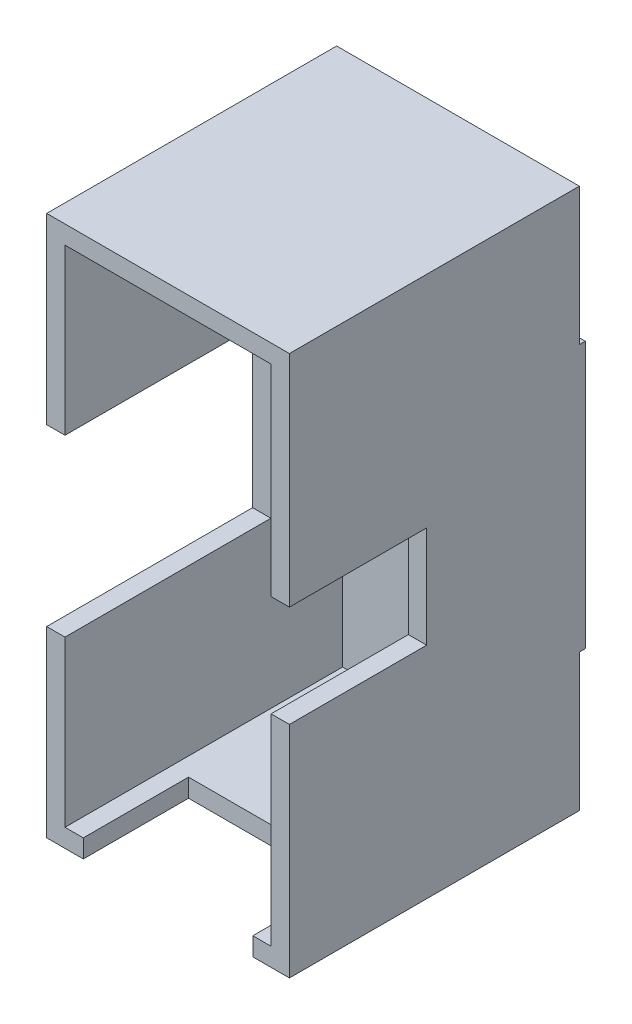
from build123d import *
from build123d.topology import SkipClean

# Parameters (mm, degrees)
SKETCH1_W           = 53.05
SKETCH1_H           = 118.2
SKETCH1_W_2         = 45.05
SKETCH1_H_2         = 110.2
BOSS_EXTRUDE1_DEPTH = 60.67
SKETCH2_W           = 53.05
SKETCH2_H           = 118.2
BOSS_EXTRUDE2_DEPTH = 4
SKETCH3_W           = 30
SKETCH3_H           = 22.2
CUT_EXTRUDE1_DEPTH  = 4
SKETCH4_W           = 45
SKETCH4_H           = 38.2
CUT_EXTRUDE2_DEPTH  = 4
SKETCH5_W           = 37.05
SKETCH5_H           = 23
CUT_EXTRUDE3_DEPTH  = 4
SKETCH6_R           = 13.5
SKETCH6_R_2         = 11.5
BOSS_EXTRUDE3_DEPTH = 3.4
SKETCH9_R           = 11.5
CUT_EXTRUDE4_DEPTH  = 5.5
SKETCH10_W          = 1.3
SKETCH10_H          = 30
CUT_EXTRUDE6_DEPTH  = 100.939788873
SKETCH8_R           = 13.5
BOSS_EXTRUDE5_DEPTH = 3
SKETCH12_R          = 3.325
CUT_EXTRUDE8_DEPTH  = 85.508097393


with BuildPart() as part:
    # Sketch1 → Boss-Extrude1 (new body)
    with BuildSketch(Plane.XY):
        Rectangle(SKETCH1_W, SKETCH1_H)
        Rectangle(SKETCH1_W_2, SKETCH1_H_2, mode=Mode.SUBTRACT)
    extrude(amount=BOSS_EXTRUDE1_DEPTH)

    # Sketch2 → Boss-Extrude2 (add)
    with BuildSketch(Plane.XY):
        Rectangle(SKETCH2_W, SKETCH2_H)
    extrude(amount=-BOSS_EXTRUDE2_DEPTH)

    # Sketch3 → Cut-Extrude1 (cut)
    with BuildSketch(Plane(origin=(26.525, 0, 0), x_dir=(0, 0, -1), z_dir=(1, 0, 0))):
        with Locations((-45.67, 0)):
            Rectangle(SKETCH3_W, SKETCH3_H)
    extrude(amount=-CUT_EXTRUDE1_DEPTH, mode=Mode.SUBTRACT)

    # Sketch4 → Cut-Extrude2 (cut)
    with BuildSketch(Plane.ZY.offset(26.525)):
        with Locations((38.17, 0)):
            Rectangle(SKETCH4_W, SKETCH4_H)
    extrude(amount=-CUT_EXTRUDE2_DEPTH, mode=Mode.SUBTRACT)

    # Sketch5 → Cut-Extrude3 (cut)
    with BuildSketch(Plane.XZ.offset(59.1)):
        with Locations((0, 49.17)):
            Rectangle(SKETCH5_W, SKETCH5_H)
    extrude(amount=-CUT_EXTRUDE3_DEPTH, mode=Mode.SUBTRACT)

    # Sketch6 → Boss-Extrude3 (add)
    with BuildSketch(Plane.XY):
        Circle(SKETCH6_R)
        Circle(SKETCH6_R_2, mode=Mode.SUBTRACT)
    extrude(amount=BOSS_EXTRUDE3_DEPTH)

    # Sketch9 → Cut-Extrude4 (cut)
    with SkipClean():  # the faces are left unmerged after this step: merging them gives an invalid solid
        with BuildSketch(Plane(origin=(0, 0, -4), x_dir=(-1, 0, 0), z_dir=(0, 0, -1))):
            Circle(SKETCH9_R)
        extrude(amount=-CUT_EXTRUDE4_DEPTH, mode=Mode.SUBTRACT)
    add(part.part.scale(1), mode=Mode.REPLACE)  # the faces are merged on a copy

    # Sketch10 → Cut-Extrude6 (cut, through all)
    with BuildSketch(Plane(origin=(26.525, 0, 0), x_dir=(0, 0, -1), z_dir=(1, 0, 0))):
        with Locations((3.35, 44.1)):
            Rectangle(SKETCH10_W, SKETCH10_H)
        with Locations((3.35, -44.1)):
            Rectangle(SKETCH10_W, SKETCH10_H)
    extrude(amount=-CUT_EXTRUDE6_DEPTH, mode=Mode.SUBTRACT)

    # Sketch8 → Boss-Extrude5 (add)
    with SkipClean():  # the faces are left unmerged after this step: merging them gives an invalid solid
        with BuildSketch(Plane.XY.offset(3.4)):
            Circle(SKETCH8_R)
        extrude(amount=BOSS_EXTRUDE5_DEPTH)

    # Sketch12 → Cut-Extrude8 (cut, through all)
    with SkipClean():  # the faces are left unmerged after this step: merging them gives an invalid solid
        with BuildSketch(Plane.XY.offset(6.4)):
            Circle(SKETCH12_R)
        extrude(amount=-CUT_EXTRUDE8_DEPTH, mode=Mode.SUBTRACT)


solid = part.part
